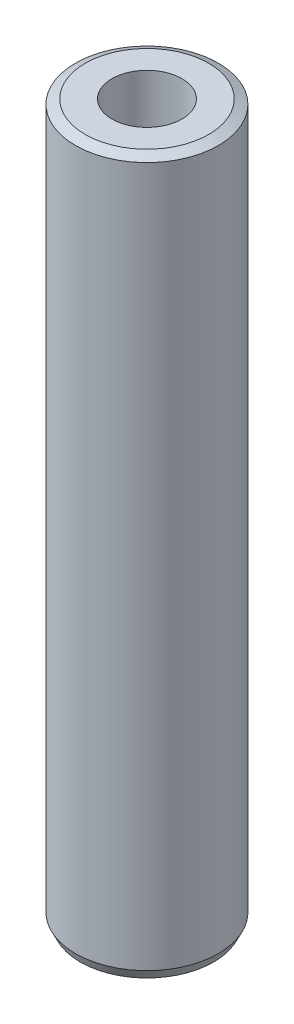
from build123d import *
from OCP.BRepFilletAPI import BRepFilletAPI_MakeChamfer

# Parameters (mm, degrees)
SKETCH1_R           = 60
BOSS_EXTRUDE1_DEPTH = 600
SKETCH2_R           = 29.414721338
CUT_EXTRUDE1_DEPTH  = 606.970296302
CHAMFER1_SIZE       = 3.962790636
CHAMFER1_SIZE2      = 8.142495435


with BuildPart() as part:
    # Sketch1 → Boss-Extrude1 (new body)
    with BuildSketch(Plane(origin=(0, 0, 0), x_dir=(1, 0, 0), z_dir=(0, 1, 0))):
        Circle(SKETCH1_R)
    extrude(amount=BOSS_EXTRUDE1_DEPTH)

    # Sketch2 → Cut-Extrude1 (cut, through all)
    with BuildSketch(Plane(origin=(0, 0, 0), x_dir=(1, 0, 0), z_dir=(0, 1, 0))):
        Circle(SKETCH2_R)
    extrude(amount=CUT_EXTRUDE1_DEPTH, mode=Mode.SUBTRACT)

    # Chamfer1: one chamfer whose edges measure the first distance from different faces: ONE call of the kernel's chamfer builder (chamfer() names one face for all edges)
    chamfer1_edges_1 = [part.edges().sort_by_distance(p)[0] for p in [
        (-60, 600, 0),
    ]]
    chamfer1_side_1 = [part.faces().sort_by_distance(p)[0] for p in [
        (-60, 300, 0),
    ]]
    chamfer1_edges_2 = [part.edges().sort_by_distance(p)[0] for p in [
        (-60, 0, 0),
    ]]
    chamfer1_side_2 = [part.faces().sort_by_distance(p)[0] for p in [
        (-58.302943725, 0, 0),
    ]]
    chamfer1 = BRepFilletAPI_MakeChamfer(part.part.solid().wrapped)
    for e in chamfer1_edges_1:
        chamfer1.Add(CHAMFER1_SIZE, CHAMFER1_SIZE2, e.wrapped, chamfer1_side_1[0].wrapped)  # the first distance lies on this face
    for e in chamfer1_edges_2:
        chamfer1.Add(CHAMFER1_SIZE, CHAMFER1_SIZE2, e.wrapped, chamfer1_side_2[0].wrapped)  # the first distance lies on this face
    add(Compound.cast(chamfer1.Shape()), mode=Mode.REPLACE)


solid = part.part
